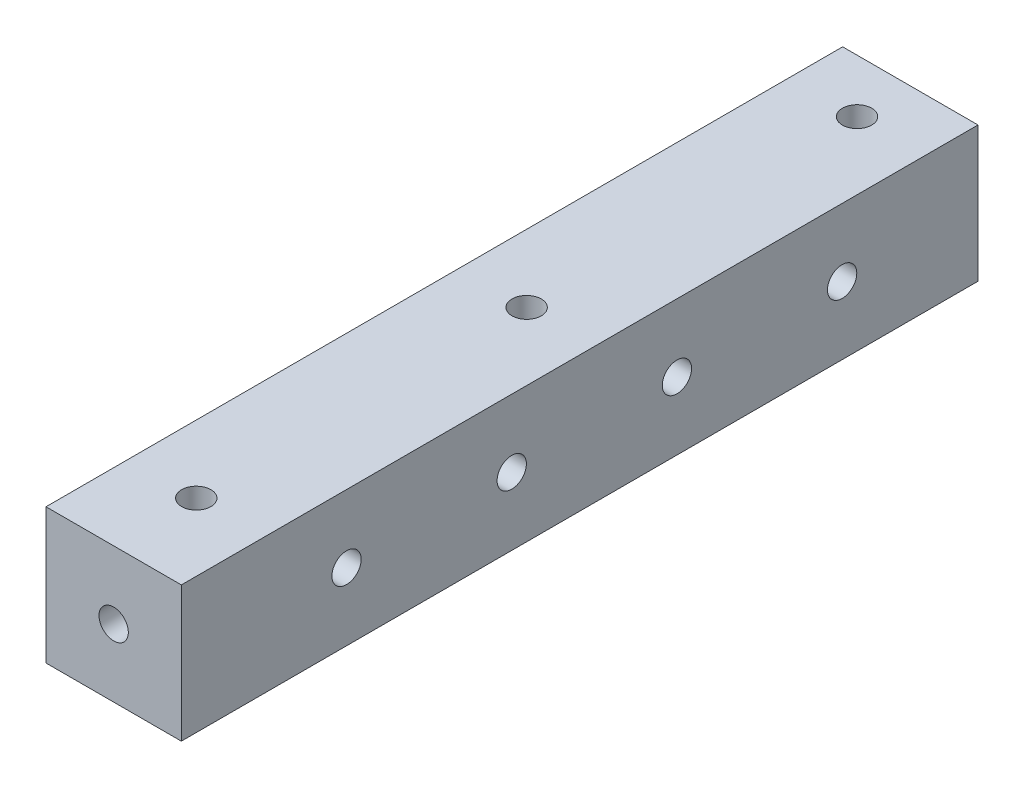
from build123d import *

# Parameters (mm, degrees)
SKETCH1_W                = 25.4
SKETCH1_H                = 25.4
BOSS_EXTRUDE1_DEPTH      = 77.5
M5_CLEARANCE_HOLE1_D     = 5.5
M5_CLEARANCE_HOLE2_D     = 5.5
M5_CLEARANCE_HOLE3_D     = 5.5
M5_CLEARANCE_HOLE3_DEPTH = 10
M5_CLEARANCE_HOLE3_TIP   = 1.652366702
SKETCH13_W               = 25.4
SKETCH13_H               = 5.5
CUT_EXTRUDE1_DEPTH       = 83.539081652


with BuildPart() as part:
    # Sketch1 → Boss-Extrude1 (new, symmetric)
    with BuildSketch(Plane.XY):
        Rectangle(SKETCH1_W, SKETCH1_H)
    extrude(amount=BOSS_EXTRUDE1_DEPTH, both=True)

    # M5 Clearance Hole1 (through all)
    with Locations(Plane(origin=(12.7, 0, 0), x_dir=(0, 0, -1), z_dir=(1, 0, 0))):
        with Locations((-46.5, 0), (-15.5, 0), (15.5, 0), (46.5, 0)):
            Hole(M5_CLEARANCE_HOLE1_D / 2)

    # M5 Clearance Hole2 (through all)
    with Locations(Plane(origin=(0, -12.7, 0), x_dir=(-1, 0, 0), z_dir=(0, -1, 0))):
        with Locations((0, -62), (0, 0), (0, 62)):
            Hole(M5_CLEARANCE_HOLE2_D / 2)

    # M5 Clearance Hole3
    with Locations(Plane.XY.offset(77.5)):
        with Locations((0, 0)):
            Hole(M5_CLEARANCE_HOLE3_D / 2, depth=M5_CLEARANCE_HOLE3_DEPTH)
            with Locations((0, 0, -(M5_CLEARANCE_HOLE3_DEPTH + M5_CLEARANCE_HOLE3_TIP / 2))):  # 118° drill point
                Cone(0, M5_CLEARANCE_HOLE3_D / 2, M5_CLEARANCE_HOLE3_TIP, mode=Mode.SUBTRACT)

    # Sketch13 → Cut-Extrude1 (cut, through all)
    with BuildSketch(Plane(origin=(0, 12.7, 0), x_dir=(1, 0, 0), z_dir=(0, 1, 0))):
        with Locations((0, 74.75)):
            Rectangle(SKETCH13_W, SKETCH13_H)
    extrude(amount=-CUT_EXTRUDE1_DEPTH, mode=Mode.SUBTRACT)


solid = part.part
